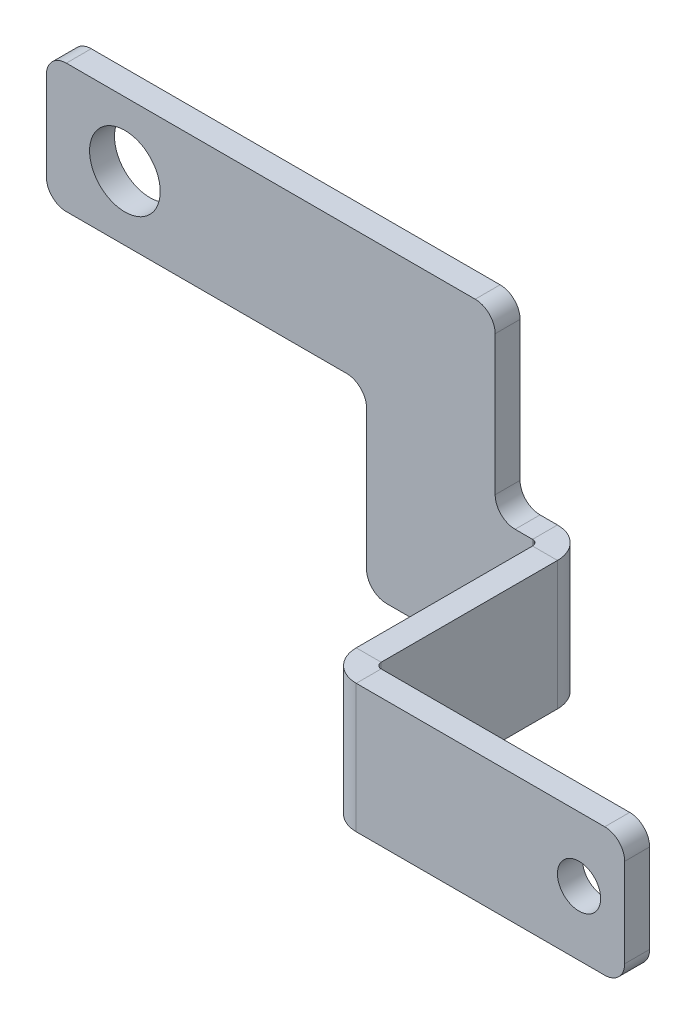
from build123d import *

# Parameters (mm, degrees)
BASE_FLANGE1_DEPTH           = 3.175
M8_CLEARANCE_HOLE1_D         = 9
EDGE_FLANGE1_DEPTH           = 16.378
EDGE_FLANGE2_STRIP_W         = 14.1732
EDGE_FLANGE2_STRIP_H         = 3.175
EDGE_FLANGE2_STRIP_CUT_DEPTH = 16.378
EDGE_FLANGE2_DEPTH           = 16.378
M5_CLEARANCE_HOLE1_D         = 5.5
FILLET1_R                    = 2.54


# Sheet-metal steps are written as plain solids
with BuildPart() as part:
    # Sketch1 → Base-Flange1 (new body)
    with BuildSketch(Plane.XY):
        Polygon((0, 0), (57.15, 0), (57.15, -16.378), (57.15, -22.8346), (61.9125, -22.8346), (61.9125, -39.2126), (57.15, -39.2126), (40.772, -39.2126), (40.772, -16.378), (0, -16.378), align=None)
    extrude(amount=-BASE_FLANGE1_DEPTH)

    # M8 Clearance Hole1 (through all)
    with Locations(Plane.XY):
        with Locations((10, -8.189)):
            Hole(M8_CLEARANCE_HOLE1_D / 2)

    # Edge-Flange1 section (across the edge) → Edge-Flange1 (add)
    with BuildSketch(Plane(origin=(62.6491, -39.2126, 0), x_dir=(-1, 0, 0), z_dir=(0, 1, 0))):
        with BuildLine():
            Line((-3.175, 0.7366), (-3.175, 23.9268))
            Line((-3.175, 23.9268), (0, 23.9268))
            Line((0, 23.9268), (0, 0.7366))
            ThreePointArc((0, 0.7366), (0.215745145, 0.215745145), (0.7366, 0))
            Line((0.7366, 0), (0.7366, -3.175))
            ThreePointArc((0.7366, -3.175), (-2.029318885, -2.029318885), (-3.175, 0.7366))
        make_face()
    extrude(amount=EDGE_FLANGE1_DEPTH)

    # Edge-Flange2 strip (across the edge) → Edge-Flange2 strip cut (cut)
    with BuildSketch(Plane(origin=(65.8241, -22.8346, 23.9268), x_dir=(0, 0, -1), z_dir=(0, -1, 0))):
        with Locations((-6.35, -1.5875)):
            Rectangle(EDGE_FLANGE2_STRIP_W, EDGE_FLANGE2_STRIP_H)
    extrude(amount=EDGE_FLANGE2_STRIP_CUT_DEPTH, mode=Mode.SUBTRACT)

    # Edge-Flange2 section (across the edge) → Edge-Flange2 (add)
    with BuildSketch(Plane(origin=(65.8241, -22.8346, 23.9268), x_dir=(0, 0, -1), z_dir=(0, -1, 0))):
        with BuildLine():
            Line((-3.175, 0.7366), (-3.175, 34.925))
            Line((-3.175, 34.925), (0, 34.925))
            Line((0, 34.925), (0, 0.7366))
            ThreePointArc((0, 0.7366), (0.215745145, 0.215745145), (0.7366, 0))
            Line((0.7366, 0), (0.7366, -3.175))
            ThreePointArc((0.7366, -3.175), (-2.029318885, -2.029318885), (-3.175, 0.7366))
        make_face()
    extrude(amount=EDGE_FLANGE2_DEPTH)

    # M5 Clearance Hole1 (through all)
    with Locations(Plane.XY.offset(27.1018)):
        with Locations((94.9349, -31.0236)):
            Hole(M5_CLEARANCE_HOLE1_D / 2)

    # Fillet1
    fillet1_edges = [part.edges().sort_by_distance(p)[0] for p in [
        (0, 0, -1.5875),
        (57.15, 0, -1.5875),
        (57.15, -22.8346, -1.5875),
        (40.772, -39.2126, -1.5875),
        (40.772, -16.378, -1.5875),
        (0, -16.378, -1.5875),
        (100.7491, -22.8346, 25.5143),
        (100.7491, -39.2126, 25.5143),
    ]]
    fillet(fillet1_edges, radius=FILLET1_R)


solid = part.part
